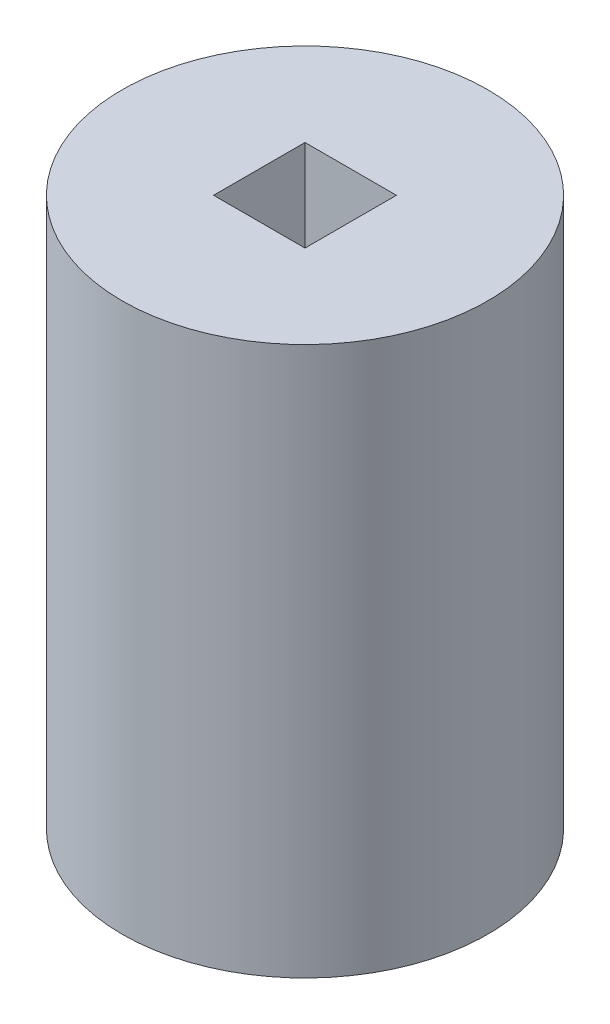
from build123d import *

# Parameters (mm, degrees)
SKETCH1_R           = 5
BOSS_EXTRUDE1_DEPTH = 15
SKETCH2_R           = 2.5
CUT_EXTRUDE1_DEPTH  = 5
SKETCH3_W           = 2.5
SKETCH3_H           = 2.5
CUT_EXTRUDE2_DEPTH  = 5


with BuildPart() as part:
    # Sketch1 → Boss-Extrude1 (new body)
    with BuildSketch(Plane(origin=(0, 0, 0), x_dir=(1, 0, 0), z_dir=(0, 1, 0))):
        Circle(SKETCH1_R)
    extrude(amount=BOSS_EXTRUDE1_DEPTH)

    # Sketch2 → Cut-Extrude1 (cut)
    with BuildSketch(Plane.XZ):
        Circle(SKETCH2_R)
    extrude(amount=-CUT_EXTRUDE1_DEPTH, mode=Mode.SUBTRACT)

    # Sketch3 → Cut-Extrude2 (cut)
    with BuildSketch(Plane(origin=(0, 15, 0), x_dir=(1, 0, 0), z_dir=(0, 1, 0))):
        Rectangle(SKETCH3_W, SKETCH3_H)
    extrude(amount=-CUT_EXTRUDE2_DEPTH, mode=Mode.SUBTRACT)


solid = part.part
